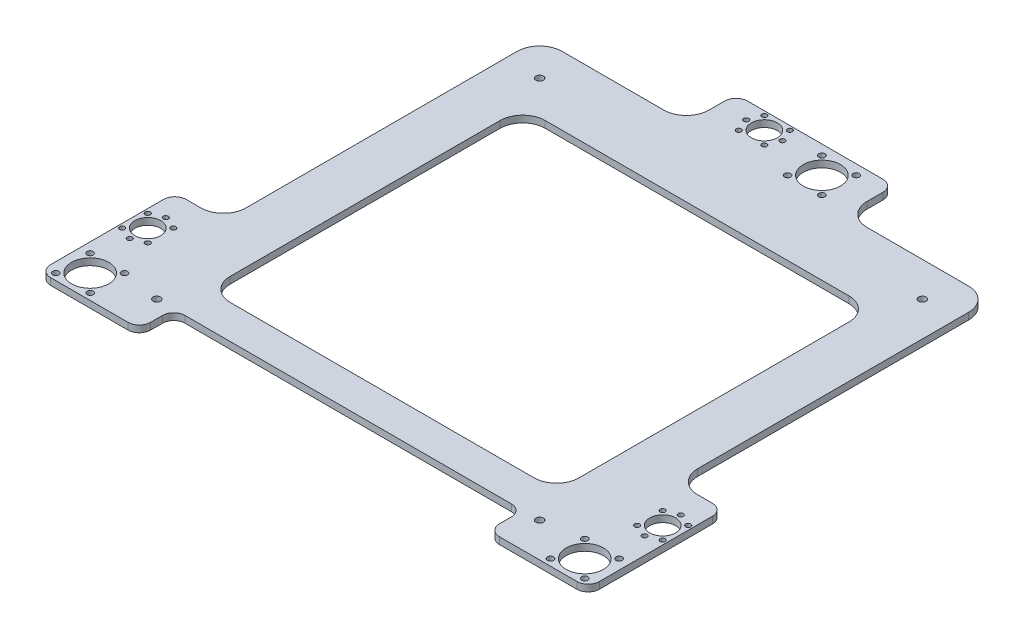
from build123d import *

# Parameters (mm, degrees)
SKETCH2_W            = 486
SKETCH2_H            = 444
BOSS_EXTRUDE1_DEPTH  = 6
M5_CLEARANCE_HOLE1_D = 5.5
M4_CLEARANCE_HOLE1_D = 4.5
SKETCH8_R            = 11.5
SKETCH8_R_2          = 16.5
CUT_EXTRUDE1_DEPTH   = 345.41399507
M5_CLEARANCE_HOLE2_D = 5.5
M4_CLEARANCE_HOLE2_D = 4.5
SKETCH13_R           = 11.5
SKETCH13_R_2         = 16.5
CUT_EXTRUDE2_DEPTH   = 345.41399507
M6_CLEARANCE_HOLE1_D = 6.6
SKETCH17_W           = 309
SKETCH17_H           = 279
CUT_EXTRUDE3_DEPTH   = 345.41399507
SKETCH18_W           = 309
SKETCH18_H           = 30.5
CUT_EXTRUDE4_DEPTH   = 345.41399507
CUT_EXTRUDE5_DEPTH   = 345.41399507
FILLET1_R            = 10
FILLET2_R            = 20


with BuildPart() as part:
    # Sketch2 → Boss-Extrude1 (new body)
    with BuildSketch(Plane(origin=(0, 0, 0), x_dir=(1, 0, 0), z_dir=(0, 1, 0))):
        with Locations((0, 22)):
            Rectangle(SKETCH2_W, SKETCH2_H)
    extrude(amount=BOSS_EXTRUDE1_DEPTH)

    # M5 Clearance Hole1 (through all)
    with Locations(Plane(origin=(0, 6, 0), x_dir=(1, 0, 0), z_dir=(0, 1, 0))):
        with Locations((-203.797204204, -163.797204204), (-234.202795796, -163.797204204), (-234.202795796, -194.202795796), (-203.797204204, -194.202795796)):
            m5_clearance_hole1 = Hole(M5_CLEARANCE_HOLE1_D / 2)

    # M4 Clearance Hole1 (through all)
    with Locations(Plane(origin=(0, 6, 0), x_dir=(1, 0, 0), z_dir=(0, 1, 0))):
        with Locations((-228, -103), (-216.686291501, -107.686291501), (-216.686291501, -130.313708499), (-228, -135), (-239.313708499, -130.313708499), (-239.313708499, -107.686291501)):
            m4_clearance_hole1 = Hole(M4_CLEARANCE_HOLE1_D / 2)

    # Sketch8 → Cut-Extrude1 (cut, through all)
    with BuildSketch(Plane(origin=(0, 6, 0), x_dir=(1, 0, 0), z_dir=(0, 1, 0))):
        with Locations((-228, -119)):
            Circle(SKETCH8_R)
        with Locations((-219, -179)):
            Circle(SKETCH8_R_2)
    cut_extrude1 = extrude(amount=-CUT_EXTRUDE1_DEPTH, mode=Mode.SUBTRACT)

    # Mirror1: M5 Clearance Hole1, M4 Clearance Hole1, Cut-Extrude1 across plane
    add(m5_clearance_hole1.mirror(Plane(origin=(0, 0, 0), x_dir=(0, 0, 1), z_dir=(1, 0, 0))), mode=Mode.SUBTRACT)
    add(m4_clearance_hole1.mirror(Plane(origin=(0, 0, 0), x_dir=(0, 0, 1), z_dir=(1, 0, 0))), mode=Mode.SUBTRACT)
    add(cut_extrude1.mirror(Plane(origin=(0, 0, 0), x_dir=(0, 0, 1), z_dir=(1, 0, 0))), mode=Mode.SUBTRACT)

    # M5 Clearance Hole2 (through all)
    with Locations(Plane(origin=(0, 6, 0), x_dir=(1, 0, 0), z_dir=(0, 1, 0))):
        with Locations((14.797204204, 204.797204204), (45.202795796, 204.797204204), (45.202795796, 235.202795796), (14.797204204, 235.202795796)):
            Hole(M5_CLEARANCE_HOLE2_D / 2)

    # M4 Clearance Hole2 (through all)
    with Locations(Plane(origin=(0, 6, 0), x_dir=(1, 0, 0), z_dir=(0, 1, 0))):
        with Locations((-18.686291501, 217.686291501), (-14, 229), (-18.686291501, 240.313708499), (-41.313708499, 240.313708499), (-46, 229), (-41.313708499, 217.686291501)):
            Hole(M4_CLEARANCE_HOLE2_D / 2)

    # Sketch13 → Cut-Extrude2 (cut, through all)
    with BuildSketch(Plane(origin=(0, 6, 0), x_dir=(1, 0, 0), z_dir=(0, 1, 0))):
        with Locations((-30, 229)):
            Circle(SKETCH13_R)
        with Locations((30, 220)):
            Circle(SKETCH13_R_2)
    extrude(amount=-CUT_EXTRUDE2_DEPTH, mode=Mode.SUBTRACT)

    # M6 Clearance Hole1 (through all)
    with Locations(Plane(origin=(0, 6, 0), x_dir=(1, 0, 0), z_dir=(0, 1, 0))):
        with Locations((-169.5, -169.5), (-169.5, 169.5), (169.5, 169.5), (169.5, -169.5)):
            Hole(M6_CLEARANCE_HOLE1_D / 2)

    # Sketch17 → Cut-Extrude3 (cut, through all)
    with BuildSketch(Plane(origin=(0, 6, 0), x_dir=(1, 0, 0), z_dir=(0, 1, 0))):
        Rectangle(SKETCH17_W, SKETCH17_H)
    extrude(amount=-CUT_EXTRUDE3_DEPTH, mode=Mode.SUBTRACT)

    # Sketch18 → Cut-Extrude4 (cut, through all)
    with BuildSketch(Plane(origin=(0, 6, 0), x_dir=(1, 0, 0), z_dir=(0, 1, 0))):
        with Locations((0, -184.75)):
            Rectangle(SKETCH18_W, SKETCH18_H)
    extrude(amount=-CUT_EXTRUDE4_DEPTH, mode=Mode.SUBTRACT)

    # Sketch19 → Cut-Extrude5 (cut, through all)
    with BuildSketch(Plane(origin=(0, 6, 0), x_dir=(1, 0, 0), z_dir=(0, 1, 0))):
        Polygon((-243, -80), (-200, -80), (-200, 200), (-70, 200), (-70, 244), (-243, 244), align=None)
    cut_extrude5 = extrude(amount=-CUT_EXTRUDE5_DEPTH, mode=Mode.SUBTRACT)

    # Mirror2: Cut-Extrude5 across plane
    add(cut_extrude5.mirror(Plane(origin=(0, 0, 0), x_dir=(0, 0, 1), z_dir=(1, 0, 0))), mode=Mode.SUBTRACT)

    # Fillet1
    fillet1_edges = [part.edges().sort_by_distance(p)[0] for p in [
        (-70, 3, -244),
        (70, 3, -244),
        (243, 3, 80),
        (243, 3, 200),
        (-243, 3, 80),
        (-243, 3, 200),
        (-154.5, 3, 200),
        (-154.5, 3, 169.5),
        (154.5, 3, 200),
        (154.5, 3, 169.5),
    ]]
    fillet(fillet1_edges, radius=FILLET1_R)

    # Fillet2
    fillet2_edges = [part.edges().sort_by_distance(p)[0] for p in [
        (200, 3, -200),
        (-200, 3, -200),
        (-154.5, 3, 139.5),
        (154.5, 3, 139.5),
        (154.5, 3, -139.5),
        (-154.5, 3, -139.5),
        (-200, 3, 80),
        (-70, 3, -200),
        (70, 3, -200),
        (200, 3, 80),
    ]]
    fillet(fillet2_edges, radius=FILLET2_R)


solid = part.part
